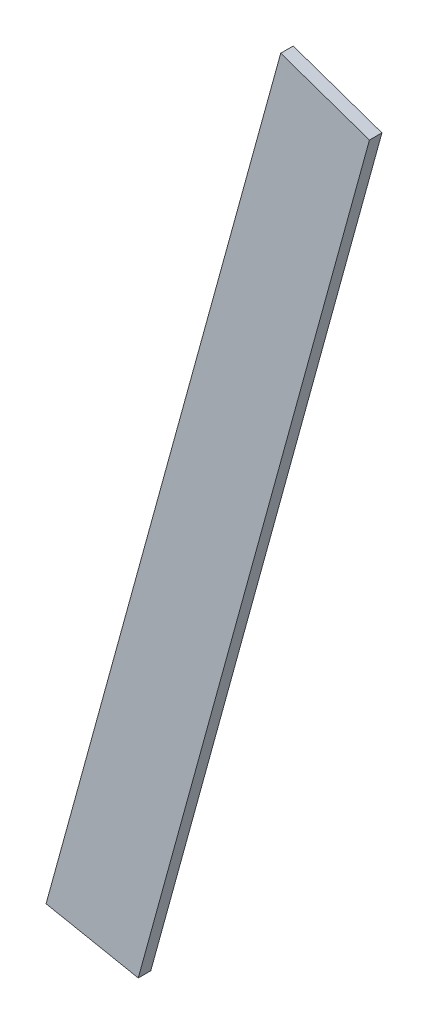
from build123d import *

# Parameters (mm, degrees)
BOSS_EXTRUDE1_DEPTH = 2


with BuildPart() as part:
    # Sketch1 → Boss-Extrude1 (new body)
    with BuildSketch(Plane.XY):
        Polygon((31.985343662, -10.916721214), (17.229414147, -8.00508562), (54.783067917, 128.657350854), (68.983136419, 123.722867607), align=None)
    extrude(amount=BOSS_EXTRUDE1_DEPTH)


solid = part.part
